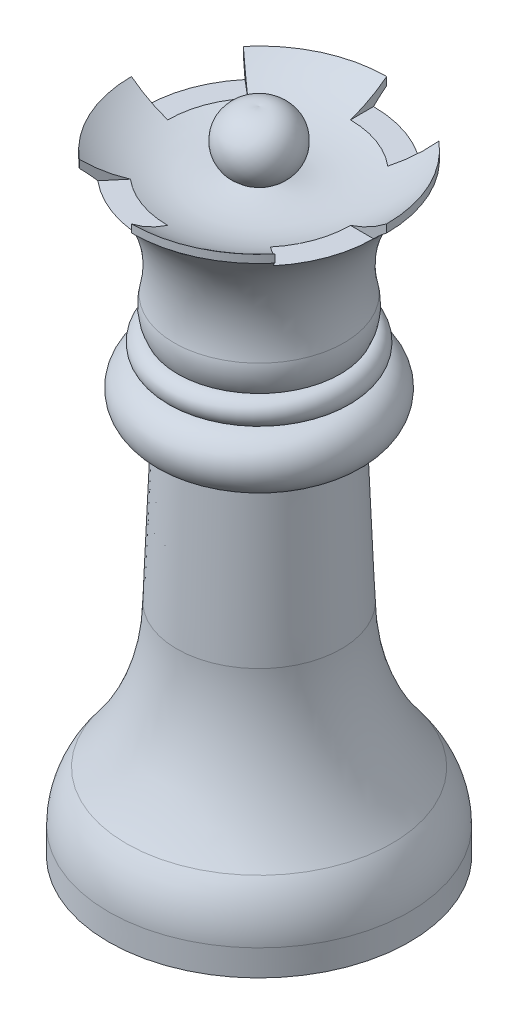
from build123d import *

# Parameters (mm, degrees)
SKETCH10_W          = 9.512793273
SKETCH10_H          = 3.277785934
CUT_REVOLVE8_ANGLE  = 40
SKETCH11_W          = 6.957754191
SKETCH11_H          = 4.403896439
CUT_REVOLVE9_ANGLE  = 40
SKETCH12_W          = 9.203214596
SKETCH12_H          = 3.33795348
CUT_REVOLVE10_ANGLE = 40
SKETCH13_W          = 8.638104201
SKETCH13_H          = 3.112891182
CUT_REVOLVE11_ANGLE = 40
CUT_EXTRUDE1_START  = -0.4
SKETCH8_R           = 10
CUT_EXTRUDE1_DEPTH  = 2


with BuildPart() as part:
    # Sketch1 → Revolve6 (revolve)
    with BuildSketch(Plane.XY):
        with BuildLine():
            Line((-11.6, 0), (0, 0))
            Line((0, 0), (0, 50))
            ThreePointArc((0, 50), (-2.670285452, 48.315824128), (-1.207945055, 45.517890367))
            ThreePointArc((-1.207945055, 45.517890367), (-5.713617748, 45.221219504), (-9.83725582, 47.060977386))
            Line((-9.83725582, 47.060977386), (-9.83725582, 46.446621373))
            ThreePointArc((-9.83725582, 46.446621373), (-6.855122073, 42.446707659), (-6.546263602, 37.467045236))
            ThreePointArc((-6.546263602, 37.467045236), (-6.602958867, 36.327795265), (-6.259730668, 35.239999672))
            ThreePointArc((-6.259730668, 35.239999672), (-7.244947935, 34.268175674), (-6.286634877, 33.269811497))
            ThreePointArc((-6.286634877, 33.269811497), (-8.418356224, 31.223574851), (-6.343236917, 29.119958876))
            Line((-6.343236917, 29.119958876), (-5.873433999, 29.119958876))
            Line((-5.873433999, 29.119958876), (-6.343236917, 16.936018409))
            ThreePointArc((-6.343236917, 16.936018409), (-7.365159743, 11.085952185), (-10.229600334, 5.88378137))
            ThreePointArc((-10.229600334, 5.88378137), (-11.234646656, 4.055708482), (-11.589655426, 2))
            Line((-11.589655426, 2), (-11.6, 0))
        make_face()
    revolve(axis=Axis((0, 50, 0), (0, -1, 0)))

    # Sketch10 → Cut-Revolve8 (revolve, cut)
    with BuildSketch(Plane.XY):
        with Locations((-9.83725582, 47.199870353)):
            Rectangle(SKETCH10_W, SKETCH10_H)
    revolve(axis=Axis((0, 0, 0), (0, -1, 0)), revolution_arc=CUT_REVOLVE8_ANGLE, mode=Mode.SUBTRACT)

    # Sketch11 → Cut-Revolve9 (revolve, cut)
    with BuildSketch(Plane.XY):
        with Locations((9.83725582, 47.762925606)):
            Rectangle(SKETCH11_W, SKETCH11_H)
    revolve(axis=Axis((0, 0, 0), (0, -1, 0)), revolution_arc=CUT_REVOLVE9_ANGLE, mode=Mode.SUBTRACT)

    # Sketch12 → Cut-Revolve10 (revolve, cut)
    with BuildSketch(Plane(origin=(0, 0, 0), x_dir=(0, 0, -1), z_dir=(1, 0, 0))):
        with Locations((9.83725582, 47.229954126)):
            Rectangle(SKETCH12_W, SKETCH12_H)
    revolve(axis=Axis((0, 0, 0), (0, -1, 0)), revolution_arc=CUT_REVOLVE10_ANGLE, mode=Mode.SUBTRACT)

    # Sketch13 → Cut-Revolve11 (revolve, cut)
    with BuildSketch(Plane(origin=(0, 0, 0), x_dir=(0, 0, -1), z_dir=(1, 0, 0))):
        with Locations((-9.83725582, 47.117422977)):
            Rectangle(SKETCH13_W, SKETCH13_H)
    revolve(axis=Axis((0, 0, 0), (0, -1, 0)), revolution_arc=CUT_REVOLVE11_ANGLE, mode=Mode.SUBTRACT)

    # Sketch8 → Cut-Extrude1 (cut)
    with BuildSketch(Plane.XZ.offset(CUT_EXTRUDE1_START)):
        Circle(SKETCH8_R)
    extrude(amount=-CUT_EXTRUDE1_DEPTH, mode=Mode.SUBTRACT)


solid = part.part
